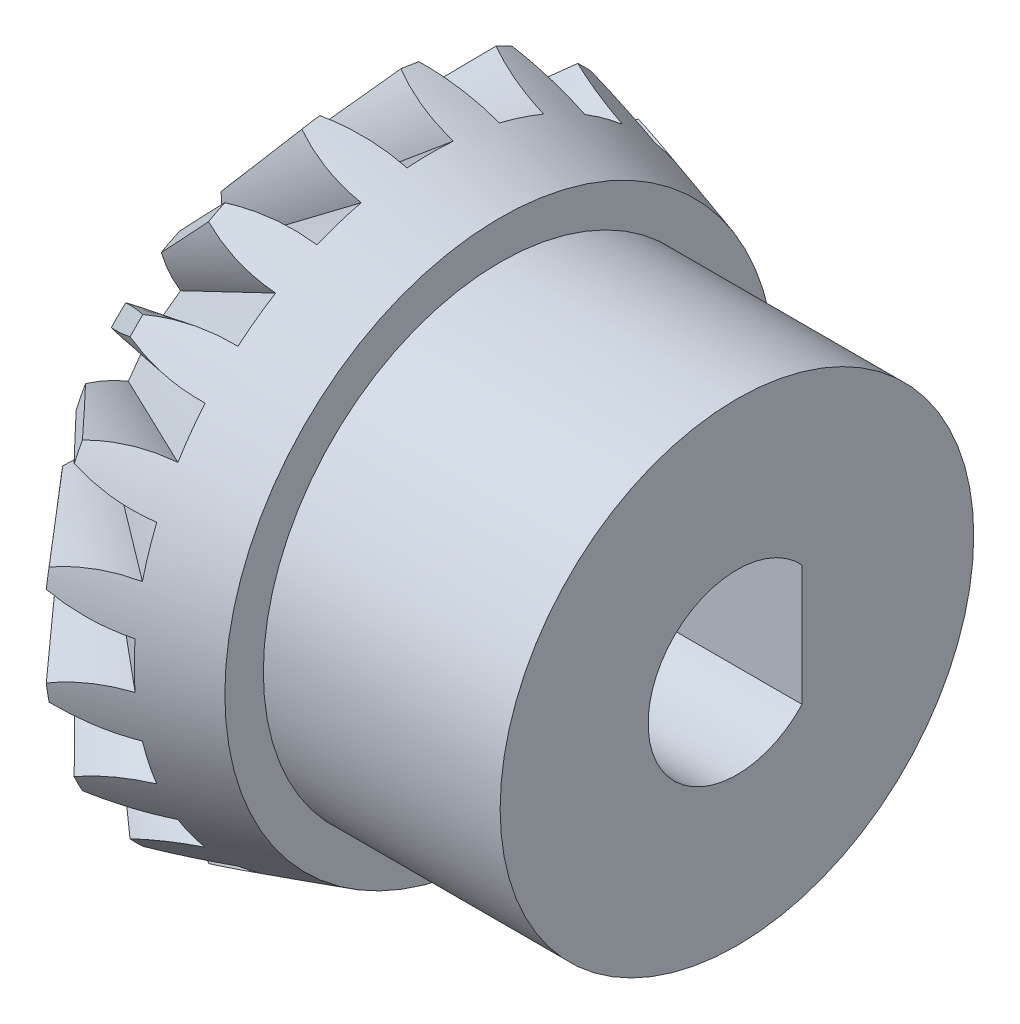
from build123d import *

# Parameters (mm, degrees)
CIRPATTERN1_COUNT   = 20
BOSS_EXTRUDE1_DEPTH = 8


with BuildPart() as part:
    # Sketch1 → Revolve1 (revolve)
    with BuildSketch(Plane.XY, mode=Mode.PRIVATE) as revolve1_sk:
        Polygon((0, 1.5), (8, 1.5), (8, 4), (4, 4), (4, 4.65), (1.639708456, 5.35), (0, 3.462844421), align=None)
    revolve(revolve1_sk.sketch.rotate(Axis((0, 0, 0), (1, 0, 0)), 90), axis=Axis((0, 0, 0), (1, 0, 0)))

    # Sketch6 for Cut-Loft1 → Cut-Loft1 section 0
    with BuildSketch(Plane(origin=(2.819854228, 0, 0), x_dir=(0, 0, -1), z_dir=(1, 0, 0))):
        with BuildLine():
            Line((-2.607480562, 8.025), (2.607480562, 8.025))
            # circular arc as an exact rational Bezier (weights 1, cos(half-angle), 1)
            Bezier((2.607480562, 8.025), (0.565515721, 7.185558531), (0.392295479, 4.984586669), weights=[1, 0.851943225, 1])
            Bezier((0.392295479, 4.984586669), (0, 5.015460992), (-0.392295479, 4.984586669), weights=[1, 0.996917334, 1])
            Bezier((-0.392295479, 4.984586669), (-0.565515721, 7.185558531), (-2.607480562, 8.025), weights=[1, 0.851943225, 1])
        make_face()
    # Sketch5 for Cut-Loft1 → Cut-Loft1 section 1
    with BuildSketch(Plane.ZY):
        with BuildLine():
            Line((-0.209878081, 2.666753868), (0.209878081, 2.666753868))
            Bezier((0.209878081, 2.666753868), (0.33323155, 4.2341083), (1.65324092, 5.088152362), weights=[1, 0.896497279, 1])
            Bezier((1.65324092, 5.088152362), (0, 5.6253229), (-1.65324092, 5.088152362), weights=[1, 0.951056516, 1])
            Bezier((-1.65324092, 5.088152362), (-0.33323155, 4.2341083), (-0.209878081, 2.666753868), weights=[1, 0.896497279, 1])
        make_face()
    cut_loft1 = loft(mode=Mode.SUBTRACT)

    # CirPattern1: Cut-Loft1 ×20 about axis
    cirpattern1_axis = Axis((0, 0, 0), (-1, 0, 0))
    for i in range(1, CIRPATTERN1_COUNT):
        add(cut_loft1.rotate(cirpattern1_axis, i * 360 / CIRPATTERN1_COUNT), mode=Mode.SUBTRACT)

    # Sketch10 → Boss-Extrude1 (add)
    with BuildSketch(Plane(origin=(8, 0, 0), x_dir=(0, 0, -1), z_dir=(1, 0, 0))):
        with BuildLine():
            Line((1.1, 1.019803903), (1.1, -1.019803903))
            ThreePointArc((1.1, -1.019803903), (1.5, 0), (1.1, 1.019803903))
        make_face()
    extrude(amount=-BOSS_EXTRUDE1_DEPTH)


solid = part.part
